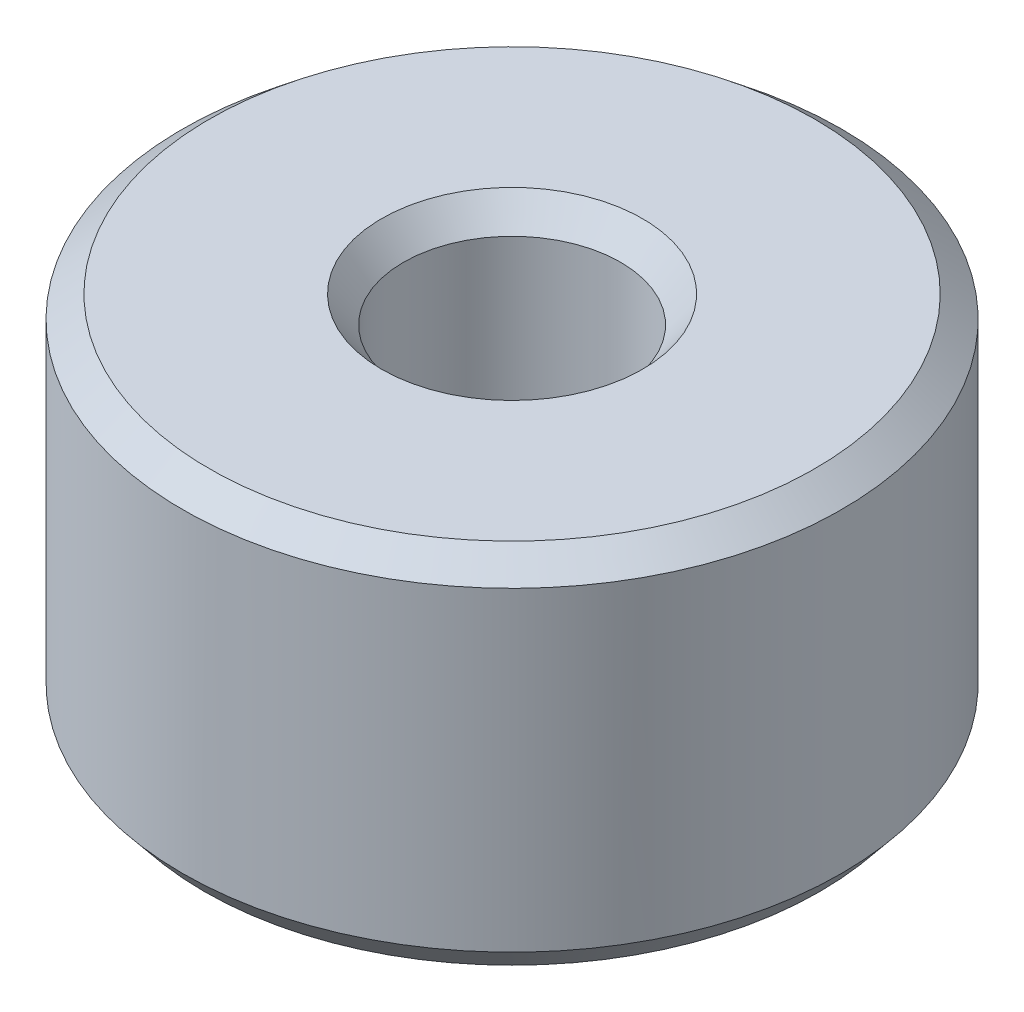
from build123d import *
from OCP.BRepFilletAPI import BRepFilletAPI_MakeChamfer

# Parameters (mm, degrees)
SKETCH1_R           = 5
BOSS_EXTRUDE1_DEPTH = 5.520238989
SKETCH2_R           = 1.647087502
CUT_EXTRUDE1_DEPTH  = 9.970676591
CHAMFER1_SIZE       = 0.332968086
CHAMFER1_SIZE2      = 0.406698638


with BuildPart() as part:
    # Sketch1 → Boss-Extrude1 (new body)
    with BuildSketch(Plane(origin=(0, 0, 0), x_dir=(1, 0, 0), z_dir=(0, 1, 0))):
        Circle(SKETCH1_R)
    extrude(amount=BOSS_EXTRUDE1_DEPTH)

    # Sketch2 → Cut-Extrude1 (cut, through all)
    with BuildSketch(Plane(origin=(0, 0, 0), x_dir=(1, 0, 0), z_dir=(0, 1, 0))):
        Circle(SKETCH2_R)
    extrude(amount=CUT_EXTRUDE1_DEPTH, mode=Mode.SUBTRACT)

    # Chamfer1: one chamfer whose edges measure the first distance from different faces: ONE call of the kernel's chamfer builder (chamfer() names one face for all edges)
    chamfer1_edges_1 = [part.edges().sort_by_distance(p)[0] for p in [
        (-1.647087502, 5.520238989, 0),
    ]]
    chamfer1_side_1 = [part.faces().sort_by_distance(p)[0] for p in [
        (-4.858578644, 5.520238989, 0),
    ]]
    chamfer1_edges_2 = [part.edges().sort_by_distance(p)[0] for p in [
        (-1.647087502, 0, 0),
    ]]
    chamfer1_side_2 = [part.faces().sort_by_distance(p)[0] for p in [
        (-1.647087502, 2.760119494, 0),
    ]]
    chamfer1_edges_3 = [part.edges().sort_by_distance(p)[0] for p in [
        (-5, 0, 0),
    ]]
    chamfer1_side_3 = [part.faces().sort_by_distance(p)[0] for p in [
        (-4.858578644, 0, 0),
    ]]
    chamfer1_edges_4 = [part.edges().sort_by_distance(p)[0] for p in [
        (-5, 5.520238989, 0),
    ]]
    chamfer1_side_4 = [part.faces().sort_by_distance(p)[0] for p in [
        (-5, 2.760119494, 0),
    ]]
    chamfer1 = BRepFilletAPI_MakeChamfer(part.part.solid().wrapped)
    for e in chamfer1_edges_1:
        chamfer1.Add(CHAMFER1_SIZE, CHAMFER1_SIZE2, e.wrapped, chamfer1_side_1[0].wrapped)  # the first distance lies on this face
    for e in chamfer1_edges_2:
        chamfer1.Add(CHAMFER1_SIZE, CHAMFER1_SIZE2, e.wrapped, chamfer1_side_2[0].wrapped)  # the first distance lies on this face
    for e in chamfer1_edges_3:
        chamfer1.Add(CHAMFER1_SIZE, CHAMFER1_SIZE2, e.wrapped, chamfer1_side_3[0].wrapped)  # the first distance lies on this face
    for e in chamfer1_edges_4:
        chamfer1.Add(CHAMFER1_SIZE, CHAMFER1_SIZE2, e.wrapped, chamfer1_side_4[0].wrapped)  # the first distance lies on this face
    add(Compound.cast(chamfer1.Shape()), mode=Mode.REPLACE)


solid = part.part
